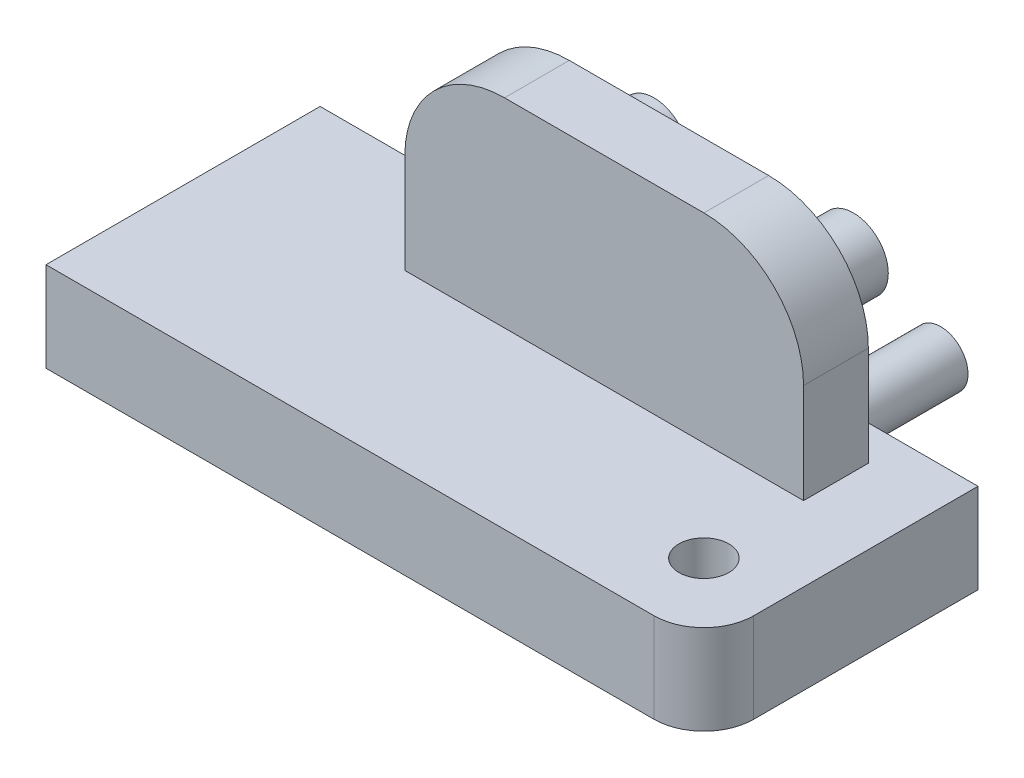
from build123d import *

# Parameters (mm, degrees)
BOSS_EXTRUDE2_DEPTH      = 8
BOSS_EXTRUDE2_DEPTH_BACK = 1
SKETCH1_R                = 2.5
CUT_EXTRUDE1_DEPTH       = 18
CUT_EXTRUDE1_DEPTH_BACK  = 18
SKETCH2_R                = 2.5
SKETCH3_R                = 2.75
BOSS_EXTRUDE3_DEPTH      = 13.75
SKETCH4_W                = 9
SKETCH4_H                = 6.5
BOSS_EXTRUDE4_DEPTH      = 15
BOSS_EXTRUDE5_DEPTH      = 8.5
SKETCH8_W                = 9
SKETCH8_H                = 6.5
BOSS_EXTRUDE6_DEPTH      = 5
SKETCH9_W                = 15.5
SKETCH9_H                = 6.5
BOSS_EXTRUDE7_DEPTH      = 20
SKETCH10_R               = 3.5
BOSS_EXTRUDE8_DEPTH      = 8.5
CUT_EXTRUDE2_START       = -8.5
SKETCH12_R               = 3.5
CUT_EXTRUDE2_DEPTH       = 8.5
FILLET1_R                = 10
BOSS_EXTRUDE9_DEPTH      = 11
BOSS_EXTRUDE9_DEPTH_BACK = 10
SKETCH13_W               = 27.5
SKETCH13_H               = 9


with BuildPart() as part:
    # Sketch1 → Boss-Extrude2 (new, two sides: drawn at the far end of the back side and taken through both)
    with BuildSketch(Plane(origin=(0, 0, 0), x_dir=(1, 0, 0), z_dir=(0, 1, 0)).offset(-BOSS_EXTRUDE2_DEPTH_BACK)):
        with BuildLine():
            Line((5, 0), (50, 0))
            ThreePointArc((50, 0), (53.535533906, 1.464466094), (55, 5))
            Line((55, 5), (55, 50))
            ThreePointArc((55, 50), (53.535533906, 53.535533906), (50, 55))
            Line((50, 55), (5, 55))
            ThreePointArc((5, 55), (1.464466094, 53.535533906), (0, 50))
            Line((0, 50), (0, 5))
            ThreePointArc((0, 5), (1.464466094, 1.464466094), (5, 0))
        make_face()
        with Locations((7.5, 47.5)):
            Circle(SKETCH1_R, mode=Mode.SUBTRACT)
        with Locations((47.5, 47.5)):
            Circle(SKETCH1_R, mode=Mode.SUBTRACT)
        with Locations((47.5, 7.5)):
            Circle(SKETCH1_R, mode=Mode.SUBTRACT)
        with Locations((7.5, 7.5)):
            Circle(SKETCH1_R, mode=Mode.SUBTRACT)
    extrude(amount=BOSS_EXTRUDE2_DEPTH + BOSS_EXTRUDE2_DEPTH_BACK)

    # Sketch2 → Cut-Extrude1 (cut, two sides: drawn at the far end of the back side and taken through both)
    with BuildSketch(Plane(origin=(0, 8, 0), x_dir=(1, 0, 0), z_dir=(0, 1, 0)).offset(-CUT_EXTRUDE1_DEPTH_BACK)):
        with BuildLine():
            Line((0, 50), (0, 27.5))
            Line((0, 27.5), (55, 27.5))
            Line((55, 27.5), (55, 50))
            ThreePointArc((55, 50), (53.535533906, 53.535533906), (50, 55))
            Line((50, 55), (5, 55))
            ThreePointArc((5, 55), (1.464466094, 53.535533906), (0, 50))
        make_face()
        with Locations((7.5, 47.5)):
            Circle(SKETCH2_R, mode=Mode.SUBTRACT)
        with Locations((47.5, 47.5)):
            Circle(SKETCH2_R, mode=Mode.SUBTRACT)
    extrude(amount=CUT_EXTRUDE1_DEPTH + CUT_EXTRUDE1_DEPTH_BACK, mode=Mode.SUBTRACT)

    # Sketch3 → Boss-Extrude3 (add)
    with BuildSketch(Plane(origin=(0, 0, -27.5), x_dir=(-1, 0, 0), z_dir=(0, 0, -1))):
        with Locations((-37.5, 3.5)):
            Circle(SKETCH3_R)
        with Locations((-17.5, 3.5)):
            Circle(SKETCH3_R)
    extrude(amount=BOSS_EXTRUDE3_DEPTH)

    # Sketch4 → Boss-Extrude4 (add)
    with BuildSketch(Plane(origin=(0, 8, 0), x_dir=(1, 0, 0), z_dir=(0, 1, 0))):
        with Locations((27.5, 20.75)):
            Rectangle(SKETCH4_W, SKETCH4_H)
    extrude(amount=BOSS_EXTRUDE4_DEPTH)

    # Sketch5 → Boss-Extrude5 (add)
    with BuildSketch(Plane(origin=(0, 0, -24), x_dir=(-1, 0, 0), z_dir=(0, 0, -1))):
        with BuildLine():
            ThreePointArc((-25.636419782, 13.037388184), (-24.436298745, 14.307742745), (-24, 16))
            ThreePointArc((-24, 16), (-29.974873734, 18.474873734), (-27.5, 12.5))
            ThreePointArc((-27.5, 12.5), (-26.685966178, 12.595980474), (-25.916578842, 12.878657751))
            ThreePointArc((-25.916578842, 12.878657751), (-25.85405917, 13.094916041), (-25.636419782, 13.037388184))
        make_face()
    extrude(amount=BOSS_EXTRUDE5_DEPTH)

    # Sketch8 → Boss-Extrude6 (add)
    with BuildSketch(Plane(origin=(0, 23, 0), x_dir=(1, 0, 0), z_dir=(0, 1, 0))):
        with Locations((27.5, 20.75)):
            Rectangle(SKETCH8_W, SKETCH8_H)
    extrude(amount=BOSS_EXTRUDE6_DEPTH)

    # Sketch9 → Boss-Extrude7 (add)
    with BuildSketch(Plane(origin=(0, 8, 0), x_dir=(1, 0, 0), z_dir=(0, 1, 0))):
        with Locations((39.75, 20.75)):
            Rectangle(SKETCH9_W, SKETCH9_H)
        with Locations((15.25, 20.75)):
            Rectangle(SKETCH9_W, SKETCH9_H)
    extrude(amount=BOSS_EXTRUDE7_DEPTH)

    # Sketch10 → Boss-Extrude8 (add)
    with BuildSketch(Plane(origin=(0, 0, -24), x_dir=(-1, 0, 0), z_dir=(0, 0, -1))):
        with Locations((-17.5, 17)):
            Circle(SKETCH10_R)
        with Locations((-37.5, 17)):
            Circle(SKETCH10_R)
    extrude(amount=BOSS_EXTRUDE8_DEPTH)

    # Sketch12 → Cut-Extrude2 (cut)
    with BuildSketch(Plane(origin=(0, 0, -32.5), x_dir=(-1, 0, 0), z_dir=(0, 0, -1)).offset(CUT_EXTRUDE2_START)):
        with Locations((-27.5, 16)):
            Circle(SKETCH12_R)
    extrude(amount=CUT_EXTRUDE2_DEPTH, mode=Mode.SUBTRACT)

    # Fillet1
    fillet1_edges = [part.edges().sort_by_distance(p)[0] for p in [
        (47.5, 28, -20.75),
        (7.5, 28, -20.75),
    ]]
    fillet(fillet1_edges, radius=FILLET1_R)

    # Sketch13 → Boss-Extrude9 (add, two sides: drawn at the far end of the back side and taken through both)
    with BuildSketch(Plane.ZY.offset(-BOSS_EXTRUDE9_DEPTH_BACK)):
        with Locations((-13.75, 3.5)):
            Rectangle(SKETCH13_W, SKETCH13_H)
    extrude(amount=BOSS_EXTRUDE9_DEPTH + BOSS_EXTRUDE9_DEPTH_BACK)


solid = part.part
